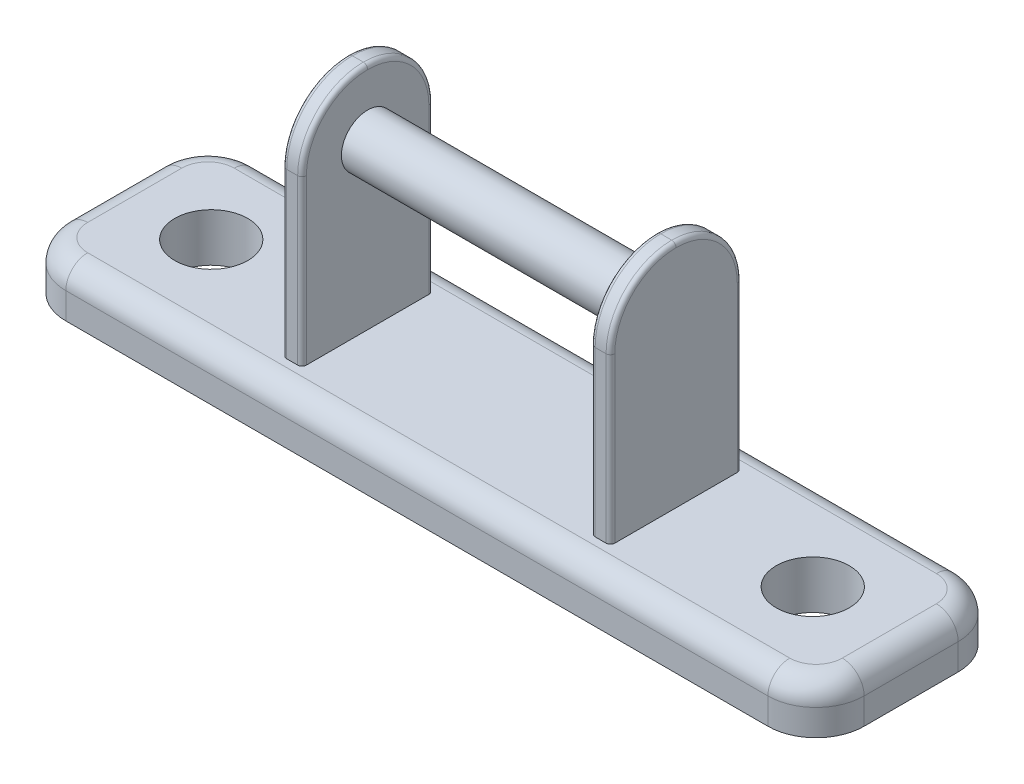
from build123d import *

# Parameters (mm, degrees)
SKETCH1_W           = 46.355
SKETCH1_H           = 11.049
SKETCH1_R           = 2.1209
BOSS_EXTRUDE1_DEPTH = 2.794
SKETCH2_W           = 1.143
SKETCH2_H           = 7.62
BOSS_EXTRUDE2_DEPTH = 13.335
FILLET1_R           = 3.81
SKETCH3_R           = 1.524
BOSS_EXTRUDE3_DEPTH = 16.764
FILLET2_R           = 2.794
FILLET3_R           = 1.27
FILLET4_R           = 0.254


with BuildPart() as part:
    # Sketch1 → Boss-Extrude1 (new body)
    with BuildSketch(Plane(origin=(0, 0, 0), x_dir=(1, 0, 0), z_dir=(0, 1, 0))):
        Rectangle(SKETCH1_W, SKETCH1_H)
        with Locations(Location((-17.4625, 0, 0), (0, 0, 270))):
            Circle(SKETCH1_R, mode=Mode.SUBTRACT)
        with Locations(Location((17.4625, 0, 0), (0, 0, 90))):
            Circle(SKETCH1_R, mode=Mode.SUBTRACT)
    extrude(amount=-BOSS_EXTRUDE1_DEPTH)

    # Sketch2 → Boss-Extrude2 (add)
    with BuildSketch(Plane(origin=(0, 0, 0), x_dir=(1, 0, 0), z_dir=(0, 1, 0))):
        with Locations((8.9535, 0)):
            Rectangle(SKETCH2_W, SKETCH2_H)
        with Locations((-8.9535, 0)):
            Rectangle(SKETCH2_W, SKETCH2_H)
    extrude(amount=BOSS_EXTRUDE2_DEPTH)

    # Fillet1
    fillet1_edges = [part.edges().sort_by_distance(p)[0] for p in [
        (-8.9535, 13.335, -3.81),
        (-8.9535, 13.335, 3.81),
        (8.9535, 13.335, -3.81),
        (8.9535, 13.335, 3.81),
    ]]
    fillet(fillet1_edges, radius=FILLET1_R - 0.0001)  # a hair under: the kernel refuses the full size

    # Sketch3 → Boss-Extrude3 (add)
    with BuildSketch(Plane(origin=(-8.382, 0, 0), x_dir=(0, 0, -1), z_dir=(1, 0, 0))):
        with Locations(Location((0, 9.525, 0), (0, 0, 180))):
            Circle(SKETCH3_R)
    extrude(amount=BOSS_EXTRUDE3_DEPTH)

    # Fillet2
    fillet2_edges = [part.edges().sort_by_distance(p)[0] for p in [
        (-23.1775, -1.397, -5.5245),
        (23.1775, -1.397, -5.5245),
        (23.1775, -1.397, 5.5245),
        (-23.1775, -1.397, 5.5245),
    ]]
    fillet(fillet2_edges, radius=FILLET2_R)

    # Fillet3
    fillet3_edges = [part.edges().sort_by_distance(p)[0] for p in [
        (0, 0, 5.5245),
        (-23.1775, 0, 0),
        (23.1775, 0, 0),
        (0, 0, -5.5245),
        (-22.359156347, 0, 4.706156347),
        (-22.359156347, 0, -4.706156347),
        (22.359156347, 0, -4.706156347),
        (22.359156347, 0, 4.706156347),
    ]]
    fillet(fillet3_edges, radius=FILLET3_R)

    # Fillet4
    fillet4_edges = [part.edges().sort_by_distance(p)[0] for p in [
        (-9.525, 4.76255, 3.81),
        (-9.525, 4.76255, -3.81),
        (-9.525, 12.219106126, 2.694106126),
        (-9.525, 12.219106126, -2.694106126),
        (-8.382, 4.76255, -3.81),
        (-8.382, 4.76255, 3.81),
        (-8.382, 12.219106126, 2.694106126),
        (-8.382, 12.219106126, -2.694106126),
        (8.382, 4.76255, 3.81),
        (8.382, 4.76255, -3.81),
        (8.382, 12.219106126, 2.694106126),
        (8.382, 12.219106126, -2.694106126),
        (9.525, 4.76255, -3.81),
        (9.525, 4.76255, 3.81),
        (9.525, 12.219106126, 2.694106126),
        (9.525, 12.219106126, -2.694106126),
    ]]
    fillet(fillet4_edges, radius=FILLET4_R)


solid = part.part
